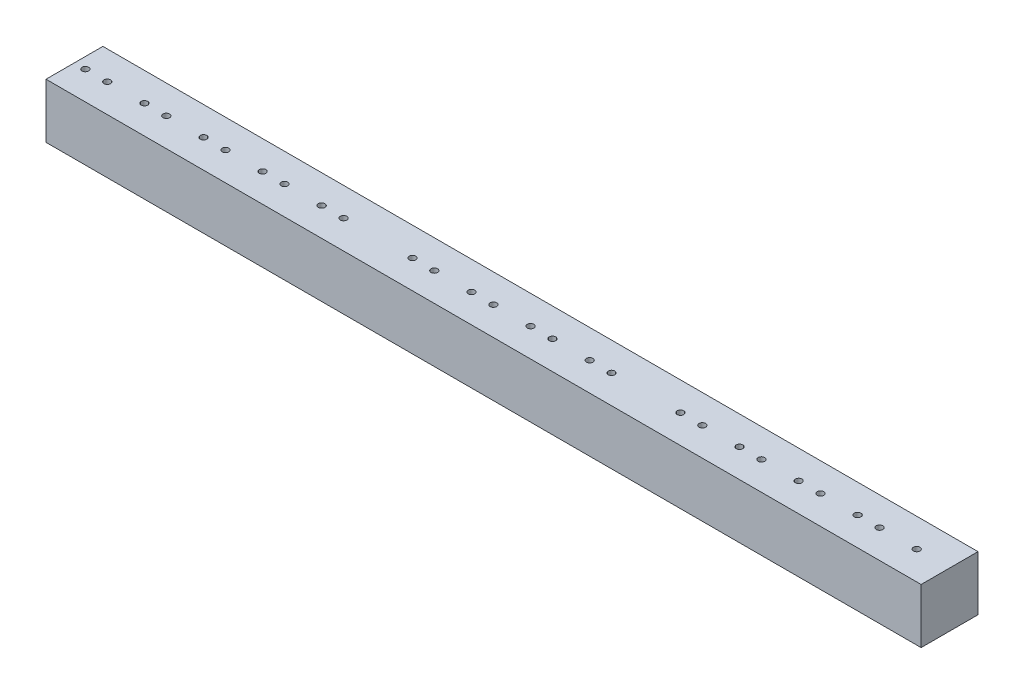
from build123d import *

# Parameters (mm, degrees)
BELT_DRIVE_AXLE_W   = 101.6
BELT_DRIVE_AXLE_H   = 6.604
BELT_DRIVE_AXLE_R   = 0.381
BOSS_EXTRUDE1_DEPTH = 6.35


with BuildPart() as part:
    # Belt Drive Axle → Boss-Extrude1 (new body)
    with BuildSketch(Plane(origin=(0, 0, 0), x_dir=(1, 0, 0), z_dir=(0, 1, 0))):
        Rectangle(BELT_DRIVE_AXLE_W, BELT_DRIVE_AXLE_H)
        with Locations((-49.53, 0)):
            Circle(BELT_DRIVE_AXLE_R, mode=Mode.SUBTRACT)
        with Locations((-46.99, 0)):
            Circle(BELT_DRIVE_AXLE_R, mode=Mode.SUBTRACT)
        with Locations((-42.672, 0)):
            Circle(BELT_DRIVE_AXLE_R, mode=Mode.SUBTRACT)
        with Locations((-40.132, 0)):
            Circle(BELT_DRIVE_AXLE_R, mode=Mode.SUBTRACT)
        with Locations((-35.814, 0)):
            Circle(BELT_DRIVE_AXLE_R, mode=Mode.SUBTRACT)
        with Locations((-33.274, 0)):
            Circle(BELT_DRIVE_AXLE_R, mode=Mode.SUBTRACT)
        with Locations((-28.956, 0)):
            Circle(BELT_DRIVE_AXLE_R, mode=Mode.SUBTRACT)
        with Locations((-26.416, 0)):
            Circle(BELT_DRIVE_AXLE_R, mode=Mode.SUBTRACT)
        with Locations((-22.098, 0)):
            Circle(BELT_DRIVE_AXLE_R, mode=Mode.SUBTRACT)
        with Locations((-19.558, 0)):
            Circle(BELT_DRIVE_AXLE_R, mode=Mode.SUBTRACT)
        with Locations((-4.699, 0)):
            Circle(BELT_DRIVE_AXLE_R, mode=Mode.SUBTRACT)
        with Locations((-2.159, 0)):
            Circle(BELT_DRIVE_AXLE_R, mode=Mode.SUBTRACT)
        with Locations((-9.017, 0)):
            Circle(BELT_DRIVE_AXLE_R, mode=Mode.SUBTRACT)
        with Locations((-11.557, 0)):
            Circle(BELT_DRIVE_AXLE_R, mode=Mode.SUBTRACT)
        with Locations((11.557, 0)):
            Circle(BELT_DRIVE_AXLE_R, mode=Mode.SUBTRACT)
        with Locations((9.017, 0)):
            Circle(BELT_DRIVE_AXLE_R, mode=Mode.SUBTRACT)
        with Locations((2.159, 0)):
            Circle(BELT_DRIVE_AXLE_R, mode=Mode.SUBTRACT)
        with Locations((4.699, 0)):
            Circle(BELT_DRIVE_AXLE_R, mode=Mode.SUBTRACT)
        with Locations((19.558, 0)):
            Circle(BELT_DRIVE_AXLE_R, mode=Mode.SUBTRACT)
        with Locations((22.098, 0)):
            Circle(BELT_DRIVE_AXLE_R, mode=Mode.SUBTRACT)
        with Locations((26.416, 0)):
            Circle(BELT_DRIVE_AXLE_R, mode=Mode.SUBTRACT)
        with Locations((28.956, 0)):
            Circle(BELT_DRIVE_AXLE_R, mode=Mode.SUBTRACT)
        with Locations((33.274, 0)):
            Circle(BELT_DRIVE_AXLE_R, mode=Mode.SUBTRACT)
        with Locations((35.814, 0)):
            Circle(BELT_DRIVE_AXLE_R, mode=Mode.SUBTRACT)
        with Locations((40.132, 0)):
            Circle(BELT_DRIVE_AXLE_R, mode=Mode.SUBTRACT)
        with Locations((42.672, 0)):
            Circle(BELT_DRIVE_AXLE_R, mode=Mode.SUBTRACT)
        with Locations((46.99, 0)):
            Circle(BELT_DRIVE_AXLE_R, mode=Mode.SUBTRACT)
    extrude(amount=BOSS_EXTRUDE1_DEPTH)


solid = part.part
